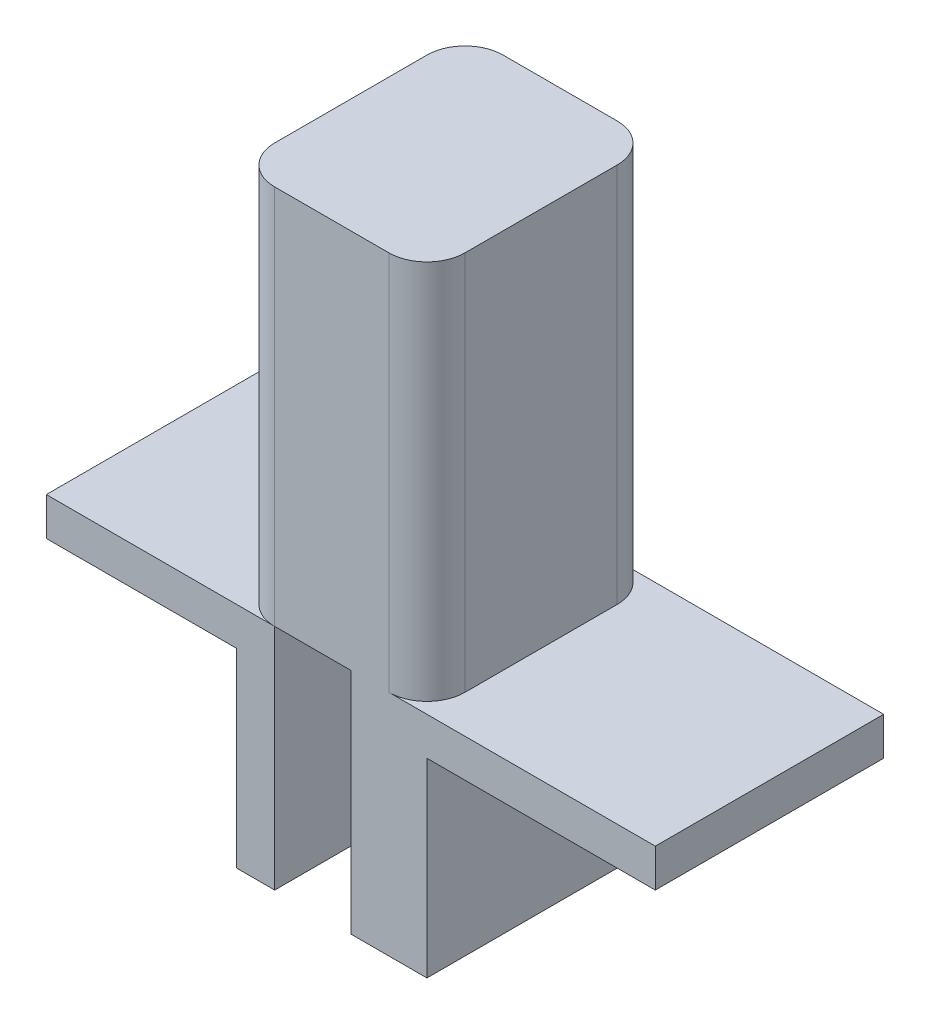
from build123d import *

# Parameters (mm, degrees)
SKETCH1_W           = 2.5
SKETCH1_H           = 3
BOSS_EXTRUDE1_DEPTH = 1
SKETCH2_W           = 1
SKETCH2_H           = 3
BOSS_EXTRUDE2_DEPTH = 3
SKETCH3_W           = 0.5
SKETCH3_H           = 3
BOSS_EXTRUDE3_DEPTH = 3
SKETCH4_W           = 3
SKETCH4_H           = 0.5
BOSS_EXTRUDE4_DEPTH = 3
SKETCH5_W           = 3
SKETCH5_H           = 0.5
BOSS_EXTRUDE5_DEPTH = 2.5
SKETCH8_W           = 2.5
SKETCH8_H           = 3
BOSS_EXTRUDE6_DEPTH = 4
FILLET1_R           = 0.5


with BuildPart() as part:
    # Sketch1 → Boss-Extrude1 (new body)
    with BuildSketch(Plane(origin=(0, 0, 0), x_dir=(1, 0, 0), z_dir=(0, 1, 0))):
        Rectangle(SKETCH1_W, SKETCH1_H)
    extrude(amount=BOSS_EXTRUDE1_DEPTH)

    # Sketch2 → Boss-Extrude2 (add)
    with BuildSketch(Plane.XZ):
        with Locations((0.75, 0)):
            Rectangle(SKETCH2_W, SKETCH2_H)
    extrude(amount=BOSS_EXTRUDE2_DEPTH)

    # Sketch3 → Boss-Extrude3 (add)
    with BuildSketch(Plane.XZ):
        with Locations((-1, 0)):
            Rectangle(SKETCH3_W, SKETCH3_H)
    extrude(amount=BOSS_EXTRUDE3_DEPTH)

    # Sketch4 → Boss-Extrude4 (add)
    with BuildSketch(Plane(origin=(1.25, 0, 0), x_dir=(0, 0, -1), z_dir=(1, 0, 0))):
        with Locations((0, -0.25)):
            Rectangle(SKETCH4_W, SKETCH4_H)
    extrude(amount=BOSS_EXTRUDE4_DEPTH)

    # Sketch5 → Boss-Extrude5 (add)
    with BuildSketch(Plane.ZY.offset(1.25)):
        with Locations((0, -0.25)):
            Rectangle(SKETCH5_W, SKETCH5_H)
    extrude(amount=BOSS_EXTRUDE5_DEPTH)

    # Sketch8 → Boss-Extrude6 (add)
    with BuildSketch(Plane(origin=(0, 1, 0), x_dir=(1, 0, 0), z_dir=(0, 1, 0))):
        Rectangle(SKETCH8_W, SKETCH8_H)
    extrude(amount=BOSS_EXTRUDE6_DEPTH)

    # Fillet1
    fillet1_edges = [part.edges().sort_by_distance(p)[0] for p in [
        (1.25, 2.5, 1.5),
        (-1.25, 2.5, 1.5),
        (-1.25, 2.5, -1.5),
        (1.25, 2.5, -1.5),
    ]]
    fillet(fillet1_edges, radius=FILLET1_R - 0.0001)  # a hair under: the kernel refuses the full size


solid = part.part
